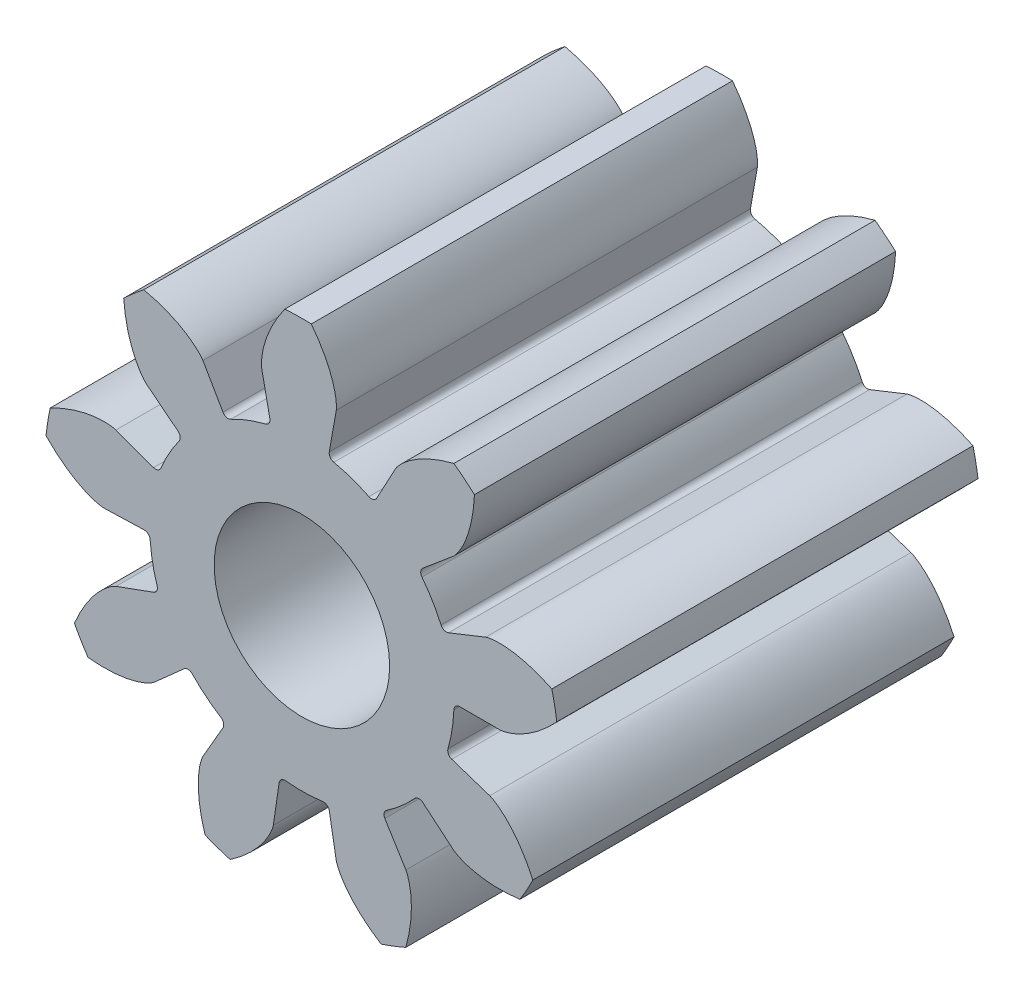
from build123d import *

# Parameters (mm, degrees)
SKETCH1_R                = 2.2
BOSS_EXTRUDE1_DEPTH      = 3.6
CUT_EXTRUDE3_START       = -3.6
CUT_EXTRUDE3_DEPTH       = 3.6
FILLET1_R                = 0.05
CIRPATTERN3_COUNT        = 9
FILLET1_OF_CIRPATTERN3_R = 0.05
SKETCH5_R                = 0.75
CUT_EXTRUDE4_DEPTH       = 7.212


# Read off the part's stored shape, not the designer's step: Cut-Extrude3
with BuildPart() as part:
    # Sketch1 → Boss-Extrude1 (new body)
    with BuildSketch(Plane.XY):
        Circle(SKETCH1_R)
    extrude(amount=-BOSS_EXTRUDE1_DEPTH)

    # Cut-Extrude3 outline → Cut-Extrude3 (cut)
    with BuildSketch(Plane.XY.offset(CUT_EXTRUDE3_START)):
        with BuildLine():
            add(Edge.make_bspline(
                [(1.974053783, -0.971139362), (1.969469023, -0.960826971), (1.95943187, -0.938870371), (1.943520204, -0.90650103), (1.920123779, -0.862434128), (1.89440744, -0.818841813), (1.866690277, -0.77587252), (1.837665608, -0.735312151), (1.810598365, -0.700977994), (1.786261022, -0.672812519), (1.765208083, -0.650169686), (1.747298664, -0.632087153), (1.72879499, -0.614582291), (1.709681102, -0.597764517), (1.689940025, -0.581712612), (1.671218112, -0.56781336), (1.653681516, -0.555970748), (1.63837702, -0.546651698), (1.626256049, -0.539971613), (1.616516296, -0.535207449), (1.610433474, -0.532545402), (1.607154972, -0.531297222), (1.605975975, -0.530879616)],
                knots=[0.280307251, 0.280307251, 0.280307251, 0.280307251, 0.280307251, 0.328394301, 0.383126635, 0.43785898, 0.492591256, 0.547323565, 0.602055884, 0.652783571, 0.680149903, 0.707515961, 0.734882063, 0.762248421, 0.789614741, 0.816980391, 0.844236067, 0.862480777, 0.880559096, 0.894007228, 0.903714168, 0.909090916, 0.909090916, 0.909090916, 0.909090916, 0.909090916], degree=4))
            ThreePointArc((1.974053783, -0.971139362), (2.17203007, -0.349693259), (2.179105615, 0.302487548))
            add(Edge.make_bspline(
                [(1.691446717, 0), (1.692697209, 2.6463e-05), (1.6962018, 0.000182576), (1.702812763, 0.000800945), (1.713555642, 0.002267439), (1.727160746, 0.004805668), (1.744616778, 0.008850326), (1.764984166, 0.01459046), (1.787122477, 0.021911283), (1.810904085, 0.030956107), (1.834330575, 0.040924951), (1.857393335, 0.051737686), (1.880073177, 0.063285415), (1.907168996, 0.078176377), (1.939116597, 0.097280069), (1.975592263, 0.121383922), (2.015880611, 0.15078501), (2.055683591, 0.182883671), (2.093782393, 0.216201853), (2.129827464, 0.250698773), (2.155094578, 0.276438398), (2.171515868, 0.294135232), (2.179105615, 0.302487548)],
                knots=[0, 0, 0, 0, 0, 0.005376748, 0.015083688, 0.02853182, 0.046610139, 0.064854849, 0.092110525, 0.119476175, 0.146842495, 0.174208853, 0.201574955, 0.228941013, 0.256307345, 0.307035032, 0.361767351, 0.41649966, 0.471231936, 0.525964281, 0.580696615, 0.628783665, 0.628783665, 0.628783665, 0.628783665, 0.628783665], degree=4))
            Line((1.691446717, 0), (1.3, 0))
            ThreePointArc((1.3, 0), (1.283472314, -0.206636926), (1.234309509, -0.408019652))
            Line((1.234309509, -0.408019652), (1.605975975, -0.530879616))
        make_face()
    cut_extrude3 = extrude(amount=CUT_EXTRUDE3_DEPTH, mode=Mode.SUBTRACT)

    # Fillet1
    fillet1_edges = [part.edges().sort_by_distance(p)[0] for p in [
        (1.234309509, -0.408019652, -1.8),
        (1.3, 0, -1.8),
    ]]
    fillet(fillet1_edges, radius=FILLET1_R)

    # CirPattern3: Cut-Extrude3 ×9 about axis
    cirpattern3_axis = Axis((0, 0, -3.6), (0, 0, 1))
    for i in range(1, CIRPATTERN3_COUNT):
        add(cut_extrude3.rotate(cirpattern3_axis, i * 360 / CIRPATTERN3_COUNT), mode=Mode.SUBTRACT)

    # Fillet1 of CirPattern3
    fillet1_of_cirpattern3_edges = [part.edges().sort_by_distance(p)[0] for p in [
        (1.207805917, 0.480837672, -1.8),
        (0.995857776, 0.835623893, -1.8),
        (0.616156514, 1.144705705, -1.8),
        (0.225742631, 1.280250079, -1.8),
        (-0.263799371, 1.272953217, -1.8),
        (-0.65, 1.125833025, -1.8),
        (-1.020320598, 0.805571771, -1.8),
        (-1.221600407, 0.444626186, -1.8),
        (-1.299422477, -0.038745659, -1.8),
        (-1.221600407, -0.444626186, -1.8),
        (-0.970510138, -0.864933565, -1.8),
        (-0.65, -1.125833025, -1.8),
        (-0.18748532, -1.286409443, -1.8),
        (0.225742631, -1.280250079, -1.8),
        (0.683265964, -1.105960046, -1.8),
        (0.995857776, -0.835623893, -1.8),
    ]]
    fillet(fillet1_of_cirpattern3_edges, radius=FILLET1_OF_CIRPATTERN3_R)

    # Sketch5 → Cut-Extrude4 (cut)
    with BuildSketch(Plane.XY):
        Circle(SKETCH5_R)
    extrude(amount=-CUT_EXTRUDE4_DEPTH, mode=Mode.SUBTRACT)


solid = part.part
